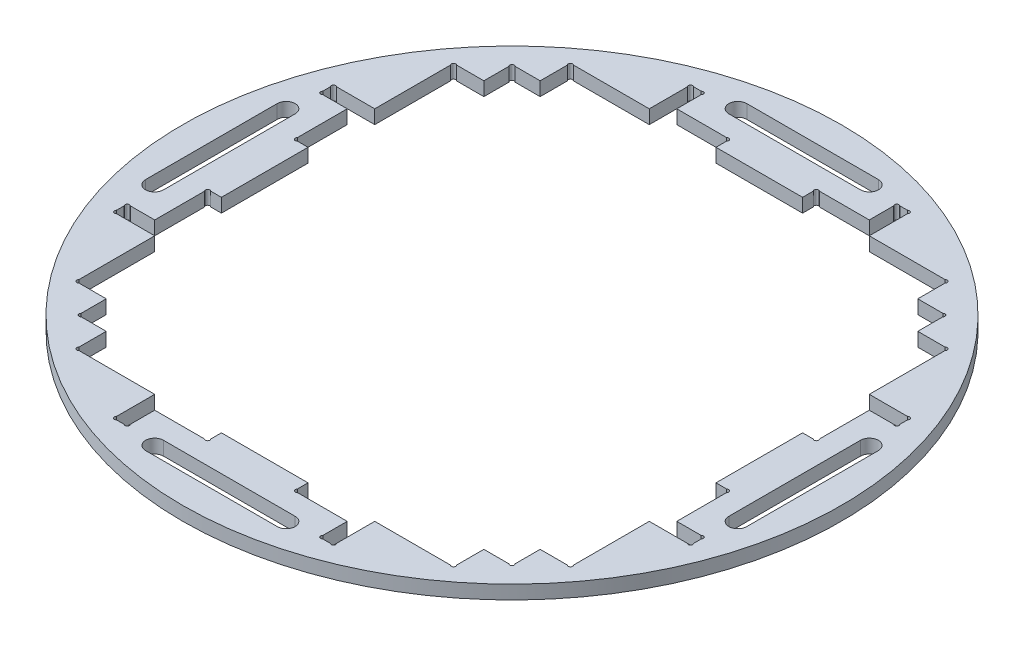
from build123d import *

# Parameters (mm, degrees)
SKETCH1_R                   = 76.1
BOSS_EXTRUDE1_DEPTH         = 3.175
SKETCH6_W                   = 100.2
SKETCH6_H                   = 100.2
RAILCUTOUT_DEPTH            = 10
SKETCH12_W                  = 87.2
SKETCH12_H                  = 7
SOLARCUTOUTS_DEPTH          = 108.66847554
SKETCH17_W                  = 50.8
SKETCH17_H                  = 3.175
WALLCUTOUT_DEPTH            = 10
SKETCH26_W                  = 20
SKETCH26_H                  = 3.175
BOSS_EXTRUDE5_DEPTH         = 3.175
SKETCH23_W                  = 3.175
SKETCH23_H                  = 6.35
RIBHOLES_DEPTH              = 108.66847554
WIREHOLE_DEPTH              = 108.66847554
SKETCH21_R                  = 0.5
BONESEED_DEPTH              = 108.66847554
SKETCH_PATTERN1_DEPTH       = 3.175
CIRPATTERN1_COUNT           = 4
CIRPATTERN1_COPY_1_SKETCH_R = 0.5
CIRPATTERN1_COPY_1_DEPTH    = 108.66847554
CIRPATTERN1_COPY_2_SKETCH_R = 0.5
CIRPATTERN1_COPY_2_DEPTH    = 108.66847554
CIRPATTERN1_COPY_3_SKETCH_R = 0.5
CIRPATTERN1_COPY_3_DEPTH    = 108.66847554
CIRPATTERN1_COPY_4_DEPTH    = 3.175
CIRPATTERN1_COPY_5_DEPTH    = 3.175
CIRPATTERN1_COPY_6_DEPTH    = 3.175
CIRPATTERN1_COPY_7_SKETCH_R = 0.5
CIRPATTERN1_COPY_7_DEPTH    = 108.66847554
CIRPATTERN1_COPY_8_SKETCH_R = 0.5
CIRPATTERN1_COPY_8_DEPTH    = 108.66847554
CIRPATTERN1_COPY_9_SKETCH_R = 0.5
CIRPATTERN1_COPY_9_DEPTH    = 108.66847554


# Read off the part's stored shape, not the designer's step: Sketch-Pattern1
with BuildPart() as part:
    # Sketch1 → Boss-Extrude1 (new body)
    with BuildSketch(Plane(origin=(0, 0, 0), x_dir=(1, 0, 0), z_dir=(0, 1, 0))):
        with Locations(Location((0, 0, 0), (0, 0, 270))):
            Circle(SKETCH1_R)
    extrude(amount=BOSS_EXTRUDE1_DEPTH)

    # Sketch6 → railCutout (cut)
    with BuildSketch(Plane(origin=(0, 3.175, 0), x_dir=(1, 0, 0), z_dir=(0, 1, 0))):
        Rectangle(SKETCH6_W, SKETCH6_H)
    extrude(amount=-RAILCUTOUT_DEPTH, mode=Mode.SUBTRACT)

    # Sketch12 → solarCutouts (cut, symmetric)
    with BuildSketch(Plane(origin=(0, 3.175, 0), x_dir=(1, 0, 0), z_dir=(0, 1, 0))):
        with Locations((0, 53.6)):
            Rectangle(SKETCH12_W, SKETCH12_H)
    solarcutouts = extrude(amount=SOLARCUTOUTS_DEPTH, both=True, mode=Mode.SUBTRACT)

    # Sketch17 → wallCutout (cut)
    with BuildSketch(Plane(origin=(0, 3.175, 0), x_dir=(1, 0, 0), z_dir=(0, 1, 0))):
        with Locations((0, 58.6875)):
            Rectangle(SKETCH17_W, SKETCH17_H)
    wallcutout = extrude(amount=-WALLCUTOUT_DEPTH, mode=Mode.SUBTRACT)

    # Sketch26 → Boss-Extrude5 (add)
    with BuildSketch(Plane(origin=(0, 3.175, 0), x_dir=(1, 0, 0), z_dir=(0, 1, 0))):
        with Locations((0, 58.6875)):
            Rectangle(SKETCH26_W, SKETCH26_H)
    boss_extrude5 = extrude(amount=-BOSS_EXTRUDE5_DEPTH)

    # Sketch23 → ribHoles (cut, symmetric)
    with BuildSketch(Plane(origin=(0, 3.175, 0), x_dir=(1, 0, 0), z_dir=(0, 1, 0))):
        with Locations((-23.8125, 63.45)):
            Rectangle(SKETCH23_W, SKETCH23_H)
        with Locations((23.8125, 63.45)):
            Rectangle(SKETCH23_W, SKETCH23_H)
    ribholes = extrude(amount=RIBHOLES_DEPTH, both=True, mode=Mode.SUBTRACT)

    # Sketch22 → wireHole (cut, symmetric)
    with BuildSketch(Plane(origin=(0, 3.175, 0), x_dir=(1, 0, 0), z_dir=(0, 1, 0))):
        with BuildLine():
            Line((-15.19543021, 69.406866366), (15.19543021, 69.406866366))
            ThreePointArc((15.19543021, 69.406866366), (17.261363394, 67.340933183), (15.19543021, 65.275))
            Line((15.19543021, 65.275), (-15.19543021, 65.275))
            ThreePointArc((-15.19543021, 65.275), (-17.261363394, 67.340933183), (-15.19543021, 69.406866366))
        make_face()
    wirehole = extrude(amount=WIREHOLE_DEPTH, both=True, mode=Mode.SUBTRACT)

    # Sketch21 → boneSeed (cut, symmetric)
    with BuildSketch(Plane(origin=(0, 3.175, 0), x_dir=(1, 0, 0), z_dir=(0, 1, 0))):
        with Locations((-49.746446609, 49.746446609)):
            Circle(SKETCH21_R)
    boneseed = extrude(amount=BONESEED_DEPTH, both=True, mode=Mode.SUBTRACT)

    # Sketch-Pattern1 outline → Sketch-Pattern1 (cut)
    with BuildSketch(Plane(origin=(0, 0, 0), x_dir=(1, 0, 0), z_dir=(0, 1, 0))):
        with BuildLine():
            Line((-25.4, 66.625), (-24.692893219, 66.625))
            ThreePointArc((-24.692893219, 66.625), (-25.046446609, 66.771446609), (-25.4, 66.625))
        make_face()
        with BuildLine():
            Line((-43.6, 56.392893219), (-43.6, 57.1))
            ThreePointArc((-43.6, 57.1), (-43.746446609, 56.746446609), (-43.6, 56.392893219))
        make_face()
        with BuildLine():
            Line((-43.6, 57.1), (-42.892893219, 57.1))
            ThreePointArc((-42.892893219, 57.1), (-43.246446609, 57.246446609), (-43.6, 57.1))
        make_face()
        with BuildLine():
            Line((-25.4, 65.917893219), (-25.4, 66.625))
            ThreePointArc((-25.4, 66.625), (-25.546446609, 66.27144661), (-25.4, 65.917893219))
        make_face()
        with BuildLine():
            Line((22.225, 66.625), (22.932106781, 66.625))
            ThreePointArc((22.932106781, 66.625), (22.578553391, 66.771446609), (22.225, 66.625))
        make_face()
        with BuildLine():
            Line((10, 59.567893219), (10, 60.275))
            ThreePointArc((10, 60.275), (9.853553391, 59.921446609), (10, 59.567893219))
        make_face()
        with BuildLine():
            Line((10, 60.275), (10.707106781, 60.275))
            ThreePointArc((10.707106781, 60.275), (10.353553391, 60.421446609), (10, 60.275))
        make_face()
        with BuildLine():
            Line((22.225, 65.917893219), (22.225, 66.625))
            ThreePointArc((22.225, 66.625), (22.078553391, 66.27144661), (22.225, 65.917893219))
        make_face()
    sketch_pattern1 = extrude(amount=SKETCH_PATTERN1_DEPTH, mode=Mode.SUBTRACT)

    # Mirror1: boneSeed, Sketch-Pattern1 across plane
    add(boneseed.mirror(Plane(origin=(0, 0, 0), x_dir=(0, 0, 1), z_dir=(1, 0, 0))), mode=Mode.SUBTRACT)
    add(sketch_pattern1.mirror(Plane(origin=(0, 0, 0), x_dir=(0, 0, 1), z_dir=(1, 0, 0))), mode=Mode.SUBTRACT)

    # CirPattern1: solarCutouts, wallCutout, Boss-Extrude5, ribHoles, wireHole, Sketch-Pattern1 ×4 about axis
    cirpattern1_axis = Axis((0, 0, 0), (0, 1, 0))
    add([solarcutouts.rotate(cirpattern1_axis, i * 360 / CIRPATTERN1_COUNT) for i in range(1, CIRPATTERN1_COUNT)], mode=Mode.SUBTRACT)
    add([wallcutout.rotate(cirpattern1_axis, i * 360 / CIRPATTERN1_COUNT) for i in range(1, CIRPATTERN1_COUNT)], mode=Mode.SUBTRACT)
    add([boss_extrude5.rotate(cirpattern1_axis, i * 360 / CIRPATTERN1_COUNT) for i in range(1, CIRPATTERN1_COUNT)])
    add([ribholes.rotate(cirpattern1_axis, i * 360 / CIRPATTERN1_COUNT) for i in range(1, CIRPATTERN1_COUNT)], mode=Mode.SUBTRACT)
    add([wirehole.rotate(cirpattern1_axis, i * 360 / CIRPATTERN1_COUNT) for i in range(1, CIRPATTERN1_COUNT)], mode=Mode.SUBTRACT)
    add([sketch_pattern1.rotate(cirpattern1_axis, i * 360 / CIRPATTERN1_COUNT) for i in range(1, CIRPATTERN1_COUNT)], mode=Mode.SUBTRACT)

    # CirPattern1 copy 1 sketch → CirPattern1 copy 1 (cut, symmetric)
    with BuildSketch(Plane.ZX.offset(3.175)):
        with Locations((-49.746446609, -49.746446609)):
            Circle(CIRPATTERN1_COPY_1_SKETCH_R)
    extrude(amount=CIRPATTERN1_COPY_1_DEPTH, both=True, mode=Mode.SUBTRACT)

    # CirPattern1 copy 2 sketch → CirPattern1 copy 2 (cut, symmetric)
    with BuildSketch(Plane(origin=(0, 3.175, 0), x_dir=(1, 0, 0), z_dir=(0, 1, 0))):
        with Locations((-49.746446609, -49.746446609)):
            Circle(CIRPATTERN1_COPY_2_SKETCH_R)
    extrude(amount=CIRPATTERN1_COPY_2_DEPTH, both=True, mode=Mode.SUBTRACT)

    # CirPattern1 copy 3 sketch → CirPattern1 copy 3 (cut, symmetric)
    with BuildSketch(Plane(origin=(0, 3.175, 0), x_dir=(0, 0, -1), z_dir=(0, 1, 0))):
        with Locations((-49.746446609, -49.746446609)):
            Circle(CIRPATTERN1_COPY_3_SKETCH_R)
    extrude(amount=CIRPATTERN1_COPY_3_DEPTH, both=True, mode=Mode.SUBTRACT)

    # CirPattern1 copy 4 sketch → CirPattern1 copy 4 (cut)
    with BuildSketch(Plane.ZX):
        with BuildLine():
            Line((-25.4, -66.625), (-24.692893219, -66.625))
            ThreePointArc((-24.692893219, -66.625), (-25.046446609, -66.771446609), (-25.4, -66.625))
        make_face()
        with BuildLine():
            Line((-43.6, -56.392893219), (-43.6, -57.1))
            ThreePointArc((-43.6, -57.1), (-43.746446609, -56.746446609), (-43.6, -56.392893219))
        make_face()
        with BuildLine():
            Line((-43.6, -57.1), (-42.892893219, -57.1))
            ThreePointArc((-42.892893219, -57.1), (-43.246446609, -57.246446609), (-43.6, -57.1))
        make_face()
        with BuildLine():
            Line((-25.4, -65.917893219), (-25.4, -66.625))
            ThreePointArc((-25.4, -66.625), (-25.546446609, -66.27144661), (-25.4, -65.917893219))
        make_face()
        with BuildLine():
            Line((22.225, -66.625), (22.932106781, -66.625))
            ThreePointArc((22.932106781, -66.625), (22.578553391, -66.771446609), (22.225, -66.625))
        make_face()
        with BuildLine():
            Line((10, -59.567893219), (10, -60.275))
            ThreePointArc((10, -60.275), (9.853553391, -59.921446609), (10, -59.567893219))
        make_face()
        with BuildLine():
            Line((10, -60.275), (10.707106781, -60.275))
            ThreePointArc((10.707106781, -60.275), (10.353553391, -60.421446609), (10, -60.275))
        make_face()
        with BuildLine():
            Line((22.225, -65.917893219), (22.225, -66.625))
            ThreePointArc((22.225, -66.625), (22.078553391, -66.27144661), (22.225, -65.917893219))
        make_face()
    extrude(amount=CIRPATTERN1_COPY_4_DEPTH, mode=Mode.SUBTRACT)

    # CirPattern1 copy 5 sketch → CirPattern1 copy 5 (cut)
    with BuildSketch(Plane(origin=(0, 0, 0), x_dir=(1, 0, 0), z_dir=(0, 1, 0))):
        with BuildLine():
            Line((-25.4, -66.625), (-24.692893219, -66.625))
            ThreePointArc((-24.692893219, -66.625), (-25.046446609, -66.771446609), (-25.4, -66.625))
        make_face()
        with BuildLine():
            Line((-43.6, -56.392893219), (-43.6, -57.1))
            ThreePointArc((-43.6, -57.1), (-43.746446609, -56.746446609), (-43.6, -56.392893219))
        make_face()
        with BuildLine():
            Line((-43.6, -57.1), (-42.892893219, -57.1))
            ThreePointArc((-42.892893219, -57.1), (-43.246446609, -57.246446609), (-43.6, -57.1))
        make_face()
        with BuildLine():
            Line((-25.4, -65.917893219), (-25.4, -66.625))
            ThreePointArc((-25.4, -66.625), (-25.546446609, -66.27144661), (-25.4, -65.917893219))
        make_face()
        with BuildLine():
            Line((22.225, -66.625), (22.932106781, -66.625))
            ThreePointArc((22.932106781, -66.625), (22.578553391, -66.771446609), (22.225, -66.625))
        make_face()
        with BuildLine():
            Line((10, -59.567893219), (10, -60.275))
            ThreePointArc((10, -60.275), (9.853553391, -59.921446609), (10, -59.567893219))
        make_face()
        with BuildLine():
            Line((10, -60.275), (10.707106781, -60.275))
            ThreePointArc((10.707106781, -60.275), (10.353553391, -60.421446609), (10, -60.275))
        make_face()
        with BuildLine():
            Line((22.225, -65.917893219), (22.225, -66.625))
            ThreePointArc((22.225, -66.625), (22.078553391, -66.27144661), (22.225, -65.917893219))
        make_face()
    extrude(amount=CIRPATTERN1_COPY_5_DEPTH, mode=Mode.SUBTRACT)

    # CirPattern1 copy 6 sketch → CirPattern1 copy 6 (cut)
    with BuildSketch(Plane(origin=(0, 0, 0), x_dir=(0, 0, -1), z_dir=(0, 1, 0))):
        with BuildLine():
            Line((-25.4, -66.625), (-24.692893219, -66.625))
            ThreePointArc((-24.692893219, -66.625), (-25.046446609, -66.771446609), (-25.4, -66.625))
        make_face()
        with BuildLine():
            Line((-43.6, -56.392893219), (-43.6, -57.1))
            ThreePointArc((-43.6, -57.1), (-43.746446609, -56.746446609), (-43.6, -56.392893219))
        make_face()
        with BuildLine():
            Line((-43.6, -57.1), (-42.892893219, -57.1))
            ThreePointArc((-42.892893219, -57.1), (-43.246446609, -57.246446609), (-43.6, -57.1))
        make_face()
        with BuildLine():
            Line((-25.4, -65.917893219), (-25.4, -66.625))
            ThreePointArc((-25.4, -66.625), (-25.546446609, -66.27144661), (-25.4, -65.917893219))
        make_face()
        with BuildLine():
            Line((22.225, -66.625), (22.932106781, -66.625))
            ThreePointArc((22.932106781, -66.625), (22.578553391, -66.771446609), (22.225, -66.625))
        make_face()
        with BuildLine():
            Line((10, -59.567893219), (10, -60.275))
            ThreePointArc((10, -60.275), (9.853553391, -59.921446609), (10, -59.567893219))
        make_face()
        with BuildLine():
            Line((10, -60.275), (10.707106781, -60.275))
            ThreePointArc((10.707106781, -60.275), (10.353553391, -60.421446609), (10, -60.275))
        make_face()
        with BuildLine():
            Line((22.225, -65.917893219), (22.225, -66.625))
            ThreePointArc((22.225, -66.625), (22.078553391, -66.27144661), (22.225, -65.917893219))
        make_face()
    extrude(amount=CIRPATTERN1_COPY_6_DEPTH, mode=Mode.SUBTRACT)

    # CirPattern1 copy 7 sketch → CirPattern1 copy 7 (cut, symmetric)
    with BuildSketch(Plane(origin=(0, 3.175, 0), x_dir=(0, 0, -1), z_dir=(0, 1, 0))):
        with Locations((-49.746446609, 49.746446609)):
            Circle(CIRPATTERN1_COPY_7_SKETCH_R)
    extrude(amount=CIRPATTERN1_COPY_7_DEPTH, both=True, mode=Mode.SUBTRACT)

    # CirPattern1 copy 8 sketch → CirPattern1 copy 8 (cut, symmetric)
    with BuildSketch(Plane(origin=(0, 3.175, 0), x_dir=(-1, 0, 0), z_dir=(0, 1, 0))):
        with Locations((-49.746446609, 49.746446609)):
            Circle(CIRPATTERN1_COPY_8_SKETCH_R)
    extrude(amount=CIRPATTERN1_COPY_8_DEPTH, both=True, mode=Mode.SUBTRACT)

    # CirPattern1 copy 9 sketch → CirPattern1 copy 9 (cut, symmetric)
    with BuildSketch(Plane.ZX.offset(3.175)):
        with Locations((-49.746446609, 49.746446609)):
            Circle(CIRPATTERN1_COPY_9_SKETCH_R)
    extrude(amount=CIRPATTERN1_COPY_9_DEPTH, both=True, mode=Mode.SUBTRACT)


solid = part.part
